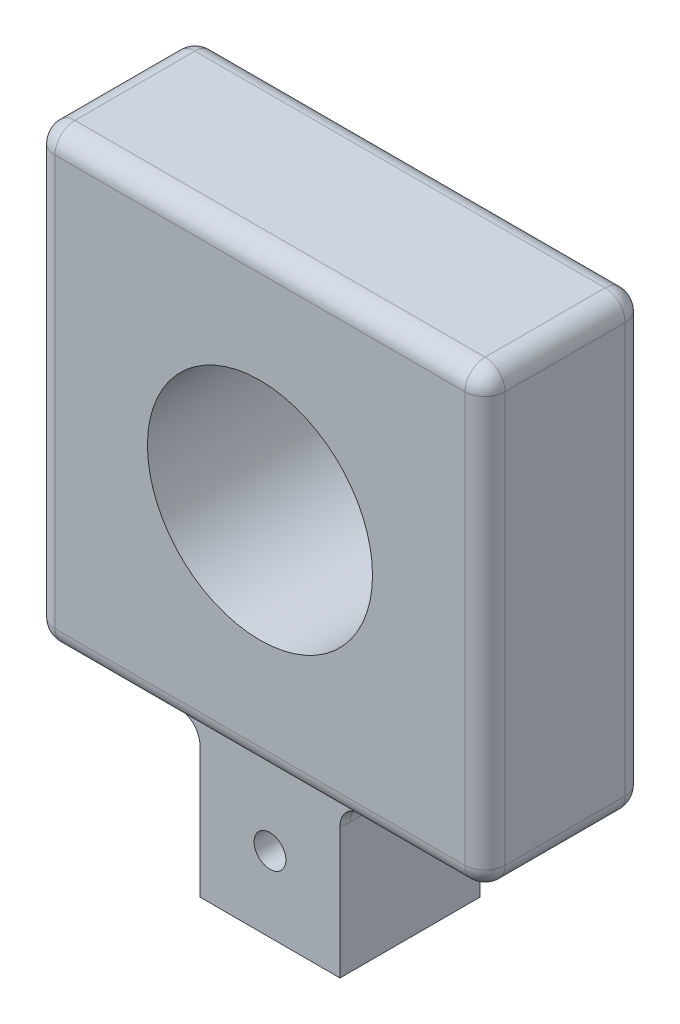
from build123d import *

# Parameters (mm, degrees)
BOSS_EXTRUDE1_DEPTH      = 12.7
BOSS_EXTRUDE1_DEPTH_BACK = 6.35
SKETCH1_W                = 17.78
SKETCH1_H                = 17.78
SKETCH2_W                = 57.15
SKETCH2_H                = 20.32
BOSS_EXTRUDE2_DEPTH      = 57.15
SKETCH3_R                = 14.2875
CUT_EXTRUDE1_DEPTH       = 79.156608966
FILLET1_R                = 2.54
SKETCH4_R                = 2.0193
CUT_EXTRUDE2_DEPTH       = 78.836081768
FILLET2_R                = 2.54


with BuildPart() as part:
    # Sketch1 → Boss-Extrude1 (new, two sides: drawn at the far end of the back side and taken through both)
    with BuildSketch(Plane(origin=(0, 0, 0), x_dir=(1, 0, 0), z_dir=(0, 1, 0)).offset(-BOSS_EXTRUDE1_DEPTH_BACK)):
        Rectangle(SKETCH1_W, SKETCH1_H)
    extrude(amount=BOSS_EXTRUDE1_DEPTH + BOSS_EXTRUDE1_DEPTH_BACK)

    # Sketch2 → Boss-Extrude2 (add)
    with BuildSketch(Plane(origin=(0, 12.7, 0), x_dir=(1, 0, 0), z_dir=(0, 1, 0))):
        Rectangle(SKETCH2_W, SKETCH2_H)
    extrude(amount=BOSS_EXTRUDE2_DEPTH)

    # Sketch3 → Cut-Extrude1 (cut, through all)
    with BuildSketch(Plane.XY.offset(10.16)):
        with Locations((0, 41.275)):
            Circle(SKETCH3_R)
    extrude(amount=-CUT_EXTRUDE1_DEPTH, mode=Mode.SUBTRACT)

    # Fillet1
    # the kernel refuses this fillet: 2.54 mm, written as the material it takes off along each edge
    with BuildSketch(Plane(origin=(26.035, 67.31, 7.62), x_dir=(0, 1, 0), z_dir=(0, 0, 1))) as fillet1_piece_1_section:
        Polygon((0, 0), (FILLET1_R, 0), (FILLET1_R, -FILLET1_R), (0, -FILLET1_R), align=None)
    fillet1_piece_1 = extrude(amount=FILLET1_R, mode=Mode.PRIVATE)
    fillet1_piece_1 = fillet1_piece_1 - Plane(origin=(26.035, 67.31, 7.62), x_dir=(-0.7071067811865475, -0.7071067811865475, 0), z_dir=(0, 0, 1)) * Sphere(FILLET1_R, mode=Mode.PRIVATE)
    add(fillet1_piece_1, mode=Mode.SUBTRACT)
    with BuildSketch(Plane(origin=(26.035, 67.31, -7.62), x_dir=(1, 0, 0), z_dir=(0, 1, 0))) as fillet1_piece_2_section:
        Polygon((0, 0), (FILLET1_R, 0), (FILLET1_R, FILLET1_R), (0, FILLET1_R), align=None)
    fillet1_piece_2 = extrude(amount=FILLET1_R, mode=Mode.PRIVATE)
    fillet1_piece_2 = fillet1_piece_2 - Plane(origin=(26.035, 67.31, -7.62), x_dir=(-0.7071067811865475, 0, 0.7071067811865475), z_dir=(0, 1, 0)) * Sphere(FILLET1_R, mode=Mode.PRIVATE)
    add(fillet1_piece_2, mode=Mode.SUBTRACT)
    with BuildSketch(Plane(origin=(26.035, 15.24, 7.62), x_dir=(0, -1, 0), z_dir=(0, 0, 1))) as fillet1_piece_3_section:
        Polygon((0, 0), (FILLET1_R, 0), (FILLET1_R, FILLET1_R), (0, FILLET1_R), align=None)
    fillet1_piece_3 = extrude(amount=FILLET1_R, mode=Mode.PRIVATE)
    fillet1_piece_3 = fillet1_piece_3 - Plane(origin=(26.035, 15.24, 7.62), x_dir=(-0.7071067811865475, 0.7071067811865475, 0), z_dir=(0, 0, 1)) * Sphere(FILLET1_R, mode=Mode.PRIVATE)
    add(fillet1_piece_3, mode=Mode.SUBTRACT)
    with BuildSketch(Plane(origin=(26.035, 15.24, -7.62), x_dir=(1, 0, 0), z_dir=(0, -1, 0))) as fillet1_piece_4_section:
        Polygon((0, 0), (FILLET1_R, 0), (FILLET1_R, -FILLET1_R), (0, -FILLET1_R), align=None)
    fillet1_piece_4 = extrude(amount=FILLET1_R, mode=Mode.PRIVATE)
    fillet1_piece_4 = fillet1_piece_4 - Plane(origin=(26.035, 15.24, -7.62), x_dir=(-0.7071067811865475, 0, 0.7071067811865475), z_dir=(0, -1, 0)) * Sphere(FILLET1_R, mode=Mode.PRIVATE)
    add(fillet1_piece_4, mode=Mode.SUBTRACT)
    with BuildSketch(Plane(origin=(-26.035, 67.31, -7.62), x_dir=(0, 1, 0), z_dir=(-1, 0, 0))) as fillet1_piece_5_section:
        Polygon((0, 0), (FILLET1_R, 0), (FILLET1_R, FILLET1_R), (0, FILLET1_R), align=None)
    fillet1_piece_5 = extrude(amount=FILLET1_R, mode=Mode.PRIVATE)
    fillet1_piece_5 = fillet1_piece_5 - Plane(origin=(-26.035, 67.31, -7.62), x_dir=(0, -0.7071067811865475, 0.7071067811865475), z_dir=(-1, 0, 0)) * Sphere(FILLET1_R, mode=Mode.PRIVATE)
    add(fillet1_piece_5, mode=Mode.SUBTRACT)
    with BuildSketch(Plane(origin=(-26.035, 67.31, 7.62), x_dir=(-1, 0, 0), z_dir=(0, 0, 1))) as fillet1_piece_6_section:
        Polygon((0, 0), (FILLET1_R, 0), (FILLET1_R, -FILLET1_R), (0, -FILLET1_R), align=None)
    fillet1_piece_6 = extrude(amount=FILLET1_R, mode=Mode.PRIVATE)
    fillet1_piece_6 = fillet1_piece_6 - Plane(origin=(-26.035, 67.31, 7.62), x_dir=(0.7071067811865475, -0.7071067811865475, 0), z_dir=(0, 0, 1)) * Sphere(FILLET1_R, mode=Mode.PRIVATE)
    add(fillet1_piece_6, mode=Mode.SUBTRACT)
    with BuildSketch(Plane(origin=(-26.035, 15.24, -7.62), x_dir=(0, -1, 0), z_dir=(-1, 0, 0))) as fillet1_piece_7_section:
        Polygon((0, 0), (FILLET1_R, 0), (FILLET1_R, -FILLET1_R), (0, -FILLET1_R), align=None)
    fillet1_piece_7 = extrude(amount=FILLET1_R, mode=Mode.PRIVATE)
    fillet1_piece_7 = fillet1_piece_7 - Plane(origin=(-26.035, 15.24, -7.62), x_dir=(0, 0.7071067811865475, 0.7071067811865475), z_dir=(-1, 0, 0)) * Sphere(FILLET1_R, mode=Mode.PRIVATE)
    add(fillet1_piece_7, mode=Mode.SUBTRACT)
    with BuildSketch(Plane(origin=(-26.035, 15.24, 7.62), x_dir=(-1, 0, 0), z_dir=(0, 0, 1))) as fillet1_piece_8_section:
        Polygon((0, 0), (FILLET1_R, 0), (FILLET1_R, FILLET1_R), (0, FILLET1_R), align=None)
    fillet1_piece_8 = extrude(amount=FILLET1_R, mode=Mode.PRIVATE)
    fillet1_piece_8 = fillet1_piece_8 - Plane(origin=(-26.035, 15.24, 7.62), x_dir=(0.7071067811865475, 0.7071067811865475, 0), z_dir=(0, 0, 1)) * Sphere(FILLET1_R, mode=Mode.PRIVATE)
    add(fillet1_piece_8, mode=Mode.SUBTRACT)
    with BuildSketch(Plane(origin=(28.575, 69.85, 7.62), x_dir=(-1, 0, 0), z_dir=(0, 0, -1)), Plane(origin=(-28.575, 12.7, -7.62), x_dir=(0, 1, 0), z_dir=(0, 0, 1))) as fillet1_piece_9:
        with BuildLine():
            CenterArc((FILLET1_R, -FILLET1_R), FILLET1_R, 90, 90)
            Line((0, -FILLET1_R), (0, 0))
            Line((0, 0), (FILLET1_R, 0))
        make_face()
    extrude(amount=15.24, mode=Mode.SUBTRACT)
    with BuildSketch(Plane(origin=(28.575, 12.7, 7.62), x_dir=(-1, 0, 0), z_dir=(0, 0, -1)), Plane(origin=(-28.575, 69.85, -7.62), x_dir=(0, -1, 0), z_dir=(0, 0, 1))) as fillet1_piece_10:
        with BuildLine():
            CenterArc((FILLET1_R, FILLET1_R), FILLET1_R, 180, 90)
            Line((0, FILLET1_R), (0, 0))
            Line((0, 0), (FILLET1_R, 0))
        make_face()
    extrude(amount=15.24, mode=Mode.SUBTRACT)
    with BuildSketch(Plane(origin=(28.575, 15.24, -10.16), x_dir=(0, 0, 1), z_dir=(0, 1, 0)), Plane(origin=(26.035, 69.85, -10.16), x_dir=(0, 0, 1), z_dir=(-1, 0, 0)), Plane(origin=(28.575, 15.24, 10.16), x_dir=(-1, 0, 0), z_dir=(0, 1, 0))) as fillet1_piece_11:
        with BuildLine():
            CenterArc((FILLET1_R, -FILLET1_R), FILLET1_R, 90, 90)
            Line((0, -FILLET1_R), (0, 0))
            Line((0, 0), (FILLET1_R, 0))
        make_face()
    extrude(amount=52.07, mode=Mode.SUBTRACT)
    with BuildSketch(Plane(origin=(-28.575, 15.24, -10.16), x_dir=(0, 0, 1), z_dir=(0, 1, 0)), Plane(origin=(-28.575, 15.24, 10.16), x_dir=(1, 0, 0), z_dir=(0, 1, 0)), Plane(origin=(-26.035, 69.85, 10.16), x_dir=(0, -1, 0), z_dir=(1, 0, 0))) as fillet1_piece_12:
        with BuildLine():
            CenterArc((FILLET1_R, FILLET1_R), FILLET1_R, 180, 90)
            Line((0, FILLET1_R), (0, 0))
            Line((0, 0), (FILLET1_R, 0))
        make_face()
    extrude(amount=52.07, mode=Mode.SUBTRACT)
    with BuildSketch(Plane(origin=(26.035, 12.7, -10.16), x_dir=(0, 0, 1), z_dir=(-1, 0, 0))) as fillet1_piece_13_section:
        with BuildLine():
            CenterArc((FILLET1_R, FILLET1_R), FILLET1_R, 180, 90)
            Line((0, FILLET1_R), (0, 0))
            Line((0, 0), (FILLET1_R, 0))
        make_face()
    fillet1_piece_13 = extrude(amount=52.07, mode=Mode.PRIVATE)
    fillet1_piece_13 = split(fillet1_piece_13, bisect_by=Plane(origin=(8.89, 12.760981289, -8.475343007), z_dir=(1, 0, 0)), keep=Keep.TOP, mode=Mode.PRIVATE)
    fillet1_piece_13 = split(fillet1_piece_13, bisect_by=Plane(origin=(17.4625, 12.760981289, -8.89), z_dir=(0, 0, 1)), keep=Keep.TOP, mode=Mode.PRIVATE)
    add(fillet1_piece_13, mode=Mode.SUBTRACT)
    with BuildSketch(Plane(origin=(26.035, 12.7, -10.16), x_dir=(0, 0, 1), z_dir=(-1, 0, 0))) as fillet1_piece_14_section:
        with BuildLine():
            CenterArc((FILLET1_R, FILLET1_R), FILLET1_R, 180, 90)
            Line((0, FILLET1_R), (0, 0))
            Line((0, 0), (FILLET1_R, 0))
        make_face()
    fillet1_piece_14 = extrude(amount=52.07, mode=Mode.PRIVATE)
    fillet1_piece_14 = split(fillet1_piece_14, bisect_by=Plane(origin=(8.89, 13.348004952, -9.742444919), z_dir=(1, 0, 0)), keep=Keep.TOP, mode=Mode.PRIVATE)
    fillet1_piece_14 = split(fillet1_piece_14, bisect_by=Plane(origin=(17.4625, 13.348004952, -8.89), z_dir=(0, 0, -1)), keep=Keep.TOP, mode=Mode.PRIVATE)
    add(fillet1_piece_14, mode=Mode.SUBTRACT)
    with BuildSketch(Plane(origin=(26.035, 12.7, -10.16), x_dir=(0, 0, 1), z_dir=(-1, 0, 0))) as fillet1_piece_15_section:
        with BuildLine():
            CenterArc((FILLET1_R, FILLET1_R), FILLET1_R, 180, 90)
            Line((0, FILLET1_R), (0, 0))
            Line((0, 0), (FILLET1_R, 0))
        make_face()
    fillet1_piece_15 = extrude(amount=52.07, mode=Mode.PRIVATE)
    fillet1_piece_15 = split(fillet1_piece_15, bisect_by=Plane(origin=(8.89, 13.348004952, -9.742444919), z_dir=(-1, 0, 0)), keep=Keep.TOP, mode=Mode.PRIVATE)
    fillet1_piece_15 = split(fillet1_piece_15, bisect_by=Plane(origin=(0, 13.348004952, -8.89), z_dir=(0, 0, -1)), keep=Keep.TOP, mode=Mode.PRIVATE)
    fillet1_piece_15 = split(fillet1_piece_15, bisect_by=Plane(origin=(-8.89, 13.348004952, -9.742444919), z_dir=(1, 0, 0)), keep=Keep.TOP, mode=Mode.PRIVATE)
    add(fillet1_piece_15, mode=Mode.SUBTRACT)
    with BuildSketch(Plane(origin=(26.035, 12.7, -10.16), x_dir=(0, 0, 1), z_dir=(-1, 0, 0))) as fillet1_piece_16_section:
        with BuildLine():
            CenterArc((FILLET1_R, FILLET1_R), FILLET1_R, 180, 90)
            Line((0, FILLET1_R), (0, 0))
            Line((0, 0), (FILLET1_R, 0))
        make_face()
    fillet1_piece_16 = extrude(amount=52.07, mode=Mode.PRIVATE)
    fillet1_piece_16 = split(fillet1_piece_16, bisect_by=Plane(origin=(-17.4625, 12.760981289, -8.89), z_dir=(0, 0, 1)), keep=Keep.TOP, mode=Mode.PRIVATE)
    fillet1_piece_16 = split(fillet1_piece_16, bisect_by=Plane(origin=(-8.89, 12.760981289, -8.475343007), z_dir=(-1, 0, 0)), keep=Keep.TOP, mode=Mode.PRIVATE)
    add(fillet1_piece_16, mode=Mode.SUBTRACT)
    with BuildSketch(Plane(origin=(26.035, 12.7, -10.16), x_dir=(0, 0, 1), z_dir=(-1, 0, 0))) as fillet1_piece_17_section:
        with BuildLine():
            CenterArc((FILLET1_R, FILLET1_R), FILLET1_R, 180, 90)
            Line((0, FILLET1_R), (0, 0))
            Line((0, 0), (FILLET1_R, 0))
        make_face()
    fillet1_piece_17 = extrude(amount=52.07, mode=Mode.PRIVATE)
    fillet1_piece_17 = split(fillet1_piece_17, bisect_by=Plane(origin=(-17.4625, 13.348004952, -8.89), z_dir=(0, 0, -1)), keep=Keep.TOP, mode=Mode.PRIVATE)
    fillet1_piece_17 = split(fillet1_piece_17, bisect_by=Plane(origin=(-8.89, 13.348004952, -9.742444919), z_dir=(-1, 0, 0)), keep=Keep.TOP, mode=Mode.PRIVATE)
    add(fillet1_piece_17, mode=Mode.SUBTRACT)
    with BuildSketch(Plane(origin=(-26.035, 12.7, 10.16), x_dir=(0, 1, 0), z_dir=(1, 0, 0))) as fillet1_piece_18_section:
        with BuildLine():
            CenterArc((FILLET1_R, -FILLET1_R), FILLET1_R, 90, 90)
            Line((0, -FILLET1_R), (0, 0))
            Line((0, 0), (FILLET1_R, 0))
        make_face()
    fillet1_piece_18 = extrude(amount=52.07, mode=Mode.PRIVATE)
    fillet1_piece_18 = split(fillet1_piece_18, bisect_by=Plane(origin=(-17.4625, 13.348004952, 8.89), z_dir=(0, 0, 1)), keep=Keep.TOP, mode=Mode.PRIVATE)
    fillet1_piece_18 = split(fillet1_piece_18, bisect_by=Plane(origin=(-8.89, 13.348004952, 9.742444919), z_dir=(-1, 0, 0)), keep=Keep.TOP, mode=Mode.PRIVATE)
    add(fillet1_piece_18, mode=Mode.SUBTRACT)
    with BuildSketch(Plane(origin=(-26.035, 12.7, 10.16), x_dir=(0, 1, 0), z_dir=(1, 0, 0))) as fillet1_piece_19_section:
        with BuildLine():
            CenterArc((FILLET1_R, -FILLET1_R), FILLET1_R, 90, 90)
            Line((0, -FILLET1_R), (0, 0))
            Line((0, 0), (FILLET1_R, 0))
        make_face()
    fillet1_piece_19 = extrude(amount=52.07, mode=Mode.PRIVATE)
    fillet1_piece_19 = split(fillet1_piece_19, bisect_by=Plane(origin=(-17.4625, 12.760981289, 8.89), z_dir=(0, 0, -1)), keep=Keep.TOP, mode=Mode.PRIVATE)
    fillet1_piece_19 = split(fillet1_piece_19, bisect_by=Plane(origin=(-8.89, 12.760981289, 8.475343007), z_dir=(-1, 0, 0)), keep=Keep.TOP, mode=Mode.PRIVATE)
    add(fillet1_piece_19, mode=Mode.SUBTRACT)
    with BuildSketch(Plane(origin=(-26.035, 12.7, 10.16), x_dir=(0, 1, 0), z_dir=(1, 0, 0))) as fillet1_piece_20_section:
        with BuildLine():
            CenterArc((FILLET1_R, -FILLET1_R), FILLET1_R, 90, 90)
            Line((0, -FILLET1_R), (0, 0))
            Line((0, 0), (FILLET1_R, 0))
        make_face()
    fillet1_piece_20 = extrude(amount=52.07, mode=Mode.PRIVATE)
    fillet1_piece_20 = split(fillet1_piece_20, bisect_by=Plane(origin=(0, 13.348004952, 8.89), z_dir=(0, 0, 1)), keep=Keep.TOP, mode=Mode.PRIVATE)
    fillet1_piece_20 = split(fillet1_piece_20, bisect_by=Plane(origin=(8.89, 13.348004952, 9.742444919), z_dir=(-1, 0, 0)), keep=Keep.TOP, mode=Mode.PRIVATE)
    fillet1_piece_20 = split(fillet1_piece_20, bisect_by=Plane(origin=(-8.89, 13.348004952, 9.742444919), z_dir=(1, 0, 0)), keep=Keep.TOP, mode=Mode.PRIVATE)
    add(fillet1_piece_20, mode=Mode.SUBTRACT)
    with BuildSketch(Plane(origin=(-26.035, 12.7, 10.16), x_dir=(0, 1, 0), z_dir=(1, 0, 0))) as fillet1_piece_21_section:
        with BuildLine():
            CenterArc((FILLET1_R, -FILLET1_R), FILLET1_R, 90, 90)
            Line((0, -FILLET1_R), (0, 0))
            Line((0, 0), (FILLET1_R, 0))
        make_face()
    fillet1_piece_21 = extrude(amount=52.07, mode=Mode.PRIVATE)
    fillet1_piece_21 = split(fillet1_piece_21, bisect_by=Plane(origin=(17.4625, 13.348004952, 8.89), z_dir=(0, 0, 1)), keep=Keep.TOP, mode=Mode.PRIVATE)
    fillet1_piece_21 = split(fillet1_piece_21, bisect_by=Plane(origin=(8.89, 13.348004952, 9.742444919), z_dir=(1, 0, 0)), keep=Keep.TOP, mode=Mode.PRIVATE)
    add(fillet1_piece_21, mode=Mode.SUBTRACT)
    with BuildSketch(Plane(origin=(-26.035, 12.7, 10.16), x_dir=(0, 1, 0), z_dir=(1, 0, 0))) as fillet1_piece_22_section:
        with BuildLine():
            CenterArc((FILLET1_R, -FILLET1_R), FILLET1_R, 90, 90)
            Line((0, -FILLET1_R), (0, 0))
            Line((0, 0), (FILLET1_R, 0))
        make_face()
    fillet1_piece_22 = extrude(amount=52.07, mode=Mode.PRIVATE)
    fillet1_piece_22 = split(fillet1_piece_22, bisect_by=Plane(origin=(17.4625, 12.760981289, 8.89), z_dir=(0, 0, -1)), keep=Keep.TOP, mode=Mode.PRIVATE)
    fillet1_piece_22 = split(fillet1_piece_22, bisect_by=Plane(origin=(8.89, 12.760981289, 8.475343007), z_dir=(1, 0, 0)), keep=Keep.TOP, mode=Mode.PRIVATE)
    add(fillet1_piece_22, mode=Mode.SUBTRACT)

    # Sketch4 → Cut-Extrude2 (cut, through all)
    with BuildSketch(Plane(origin=(0, 0, -8.89), x_dir=(-1, 0, 0), z_dir=(0, 0, -1))):
        with Locations((0, 3.175)):
            Circle(SKETCH4_R)
    extrude(amount=-CUT_EXTRUDE2_DEPTH, mode=Mode.SUBTRACT)

    # Fillet2
    fillet2_edges = [part.edges().sort_by_distance(p)[0] for p in [
        (8.89, 12.7, 0),
        (-8.89, 12.7, 0),
        (-8.89, 12.786548401, -8.277400375),
        (8.89, 12.786548401, -8.277400375),
        (8.89, 12.786548401, 8.277400375),
        (-8.89, 12.786548401, 8.277400375),
    ]]
    fillet(fillet2_edges, radius=FILLET2_R)


solid = part.part
